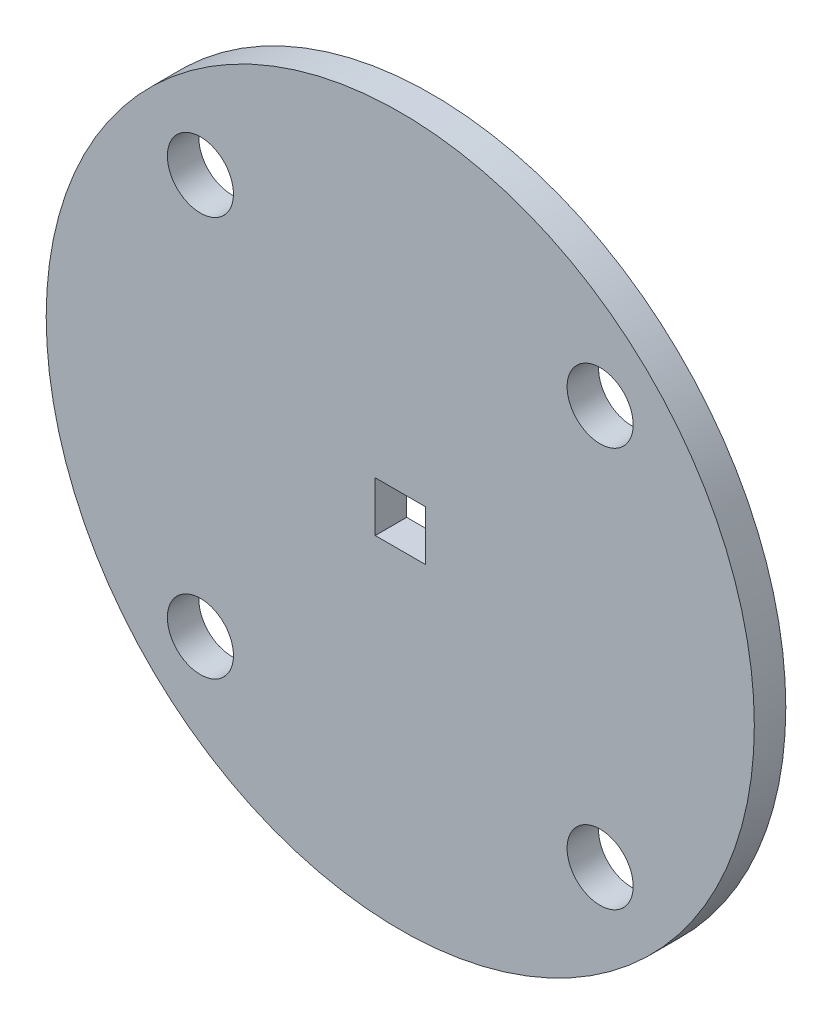
from build123d import *

# Parameters (mm, degrees)
SKETCH1_R          = 24
BASE_FLANGE1_DEPTH = 2
SKETCH6_R          = 2.1
SKETCH6_W          = 3.18
SKETCH6_H          = 3.18
CUT_EXTRUDE1_DEPTH = 10
SKETCH8_R          = 24
SKETCH8_R_2        = 22.5
CUT_EXTRUDE3_DEPTH = 10


# Sheet-metal steps are written as plain solids
with BuildPart() as part:
    # Sketch1 → Base-Flange1 (new body)
    with BuildSketch(Plane.XY):
        Circle(SKETCH1_R)
    extrude(amount=-BASE_FLANGE1_DEPTH)

    # Sketch6 → Cut-Extrude1 (cut)
    with BuildSketch(Plane.XY):
        with Locations((-12.7, 12.7)):
            Circle(SKETCH6_R)
        with Locations((12.7, 12.7)):
            Circle(SKETCH6_R)
        with Locations((12.7, -12.7)):
            Circle(SKETCH6_R)
        with Locations((-12.7, -12.7)):
            Circle(SKETCH6_R)
        Rectangle(SKETCH6_W, SKETCH6_H)
    extrude(amount=-CUT_EXTRUDE1_DEPTH, mode=Mode.SUBTRACT)

    # Sketch8 → Cut-Extrude3 (cut)
    with BuildSketch(Plane.XY):
        Circle(SKETCH8_R)
        Circle(SKETCH8_R_2, mode=Mode.SUBTRACT)
    extrude(amount=-CUT_EXTRUDE3_DEPTH, mode=Mode.SUBTRACT)


solid = part.part
